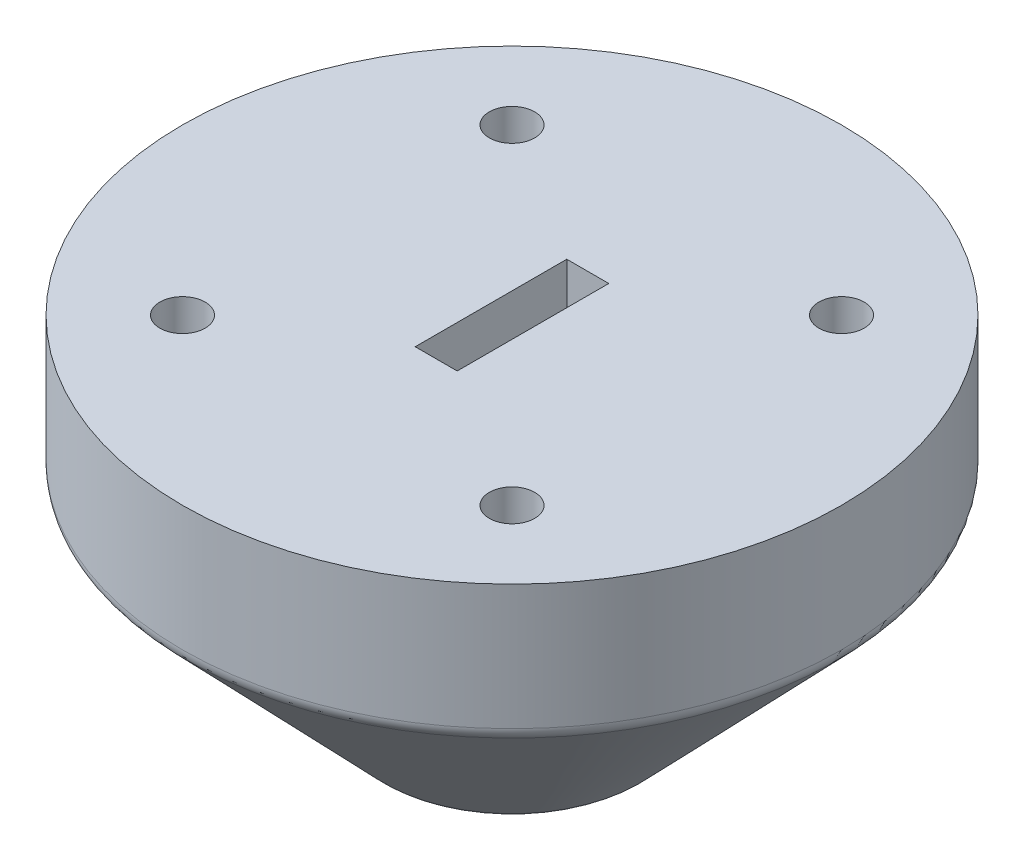
from build123d import *

# Parameters (mm, degrees)
F_5_0MM_DOWEL_HOLE7_D     = 5.5
F_5_0MM_DOWEL_HOLE7_DEPTH = 11.5
F_5_0MM_DOWEL_HOLE7_TIP   = 2.75
CUT_EXTRUDE1_DEPTH        = 9.2
CUT_EXTRUDE1_DEPTH_BACK   = 9.2
BOSS_EXTRUDE2_DEPTH       = 10
BOSS_EXTRUDE2_DEPTH_BACK  = 10
FILLET1_R                 = 2
FILLET2_R                 = 2
FILLET6_R                 = 1
FILLET7_R                 = 1
FILLET8_R                 = 2
FILLET9_R                 = 2


with BuildPart() as part:
    # Sketch1 → Revolve1 (revolve)
    with BuildSketch(Plane.XY):
        Polygon((0, 0), (40, 0), (40, -16), (15, -42), (0, -42), align=None)
    revolve(axis=Axis((0, -42, 0), (0, 1, 0)))

    # Ø5.0mm Dowel Hole7
    with Locations(Plane(origin=(0, 0, 0), x_dir=(1, 0, 0), z_dir=(0, 1, 0))):
        with Locations((20, -20), (-20, 20), (-20, -20), (20, 20)):
            Hole(F_5_0MM_DOWEL_HOLE7_D / 2, depth=F_5_0MM_DOWEL_HOLE7_DEPTH)
            with Locations((0, 0, -(F_5_0MM_DOWEL_HOLE7_DEPTH + F_5_0MM_DOWEL_HOLE7_TIP / 2))):  # 90° drill point
                Cone(0, F_5_0MM_DOWEL_HOLE7_D / 2, F_5_0MM_DOWEL_HOLE7_TIP, mode=Mode.SUBTRACT)

    # Sketch13 → Cut-Extrude1 (cut, two sides: drawn at the far end of the back side and taken through both)
    with BuildSketch(Plane.XY.offset(-CUT_EXTRUDE1_DEPTH_BACK)):
        Polygon((-2.55, 0), (2.55, 0), (2.55, -20), (1, -40), (-1, -40), (-2.55, -20), align=None)
    extrude(amount=CUT_EXTRUDE1_DEPTH + CUT_EXTRUDE1_DEPTH_BACK, mode=Mode.SUBTRACT)

    # Sketch16 → Boss-Extrude2 (add, two sides: drawn at the far end of the back side and taken through both)
    with BuildSketch(Plane(origin=(0, 0, 0), x_dir=(0, 0, -1), z_dir=(1, 0, 0)).offset(-BOSS_EXTRUDE2_DEPTH_BACK)):
        Polygon((9.2, -32), (13.2, -28), (9.2, -24), (5.2, -28), align=None)
        Polygon((-9.2, -32), (-13.2, -28), (-9.2, -24), (-5.2, -28), align=None)
    extrude(amount=BOSS_EXTRUDE2_DEPTH + BOSS_EXTRUDE2_DEPTH_BACK)

    # Fillet1
    fillet1_edges = [part.edges().sort_by_distance(p)[0] for p in [
        (-15, -42, 0),
    ]]
    fillet(fillet1_edges, radius=FILLET1_R)

    # Fillet2
    fillet2_edges = [part.edges().sort_by_distance(p)[0] for p in [
        (-40, -16, 0),
    ]]
    fillet(fillet2_edges, radius=FILLET2_R)

    # Fillet6
    fillet6_edges = [part.edges().sort_by_distance(p)[0] for p in [
        (1, -40, 0),
    ]]
    fillet(fillet6_edges, radius=FILLET6_R)

    # Fillet7
    fillet7_edges = [part.edges().sort_by_distance(p)[0] for p in [
        (-1, -40, 0),
    ]]
    fillet(fillet7_edges, radius=FILLET7_R)

    # Fillet8
    fillet8_edges = [part.edges().sort_by_distance(p)[0] for p in [
        (0, -28, -5.2),
    ]]
    fillet(fillet8_edges, radius=FILLET8_R)

    # Fillet9
    fillet9_edges = [part.edges().sort_by_distance(p)[0] for p in [
        (0, -28, 5.2),
    ]]
    fillet(fillet9_edges, radius=FILLET9_R)


solid = part.part
